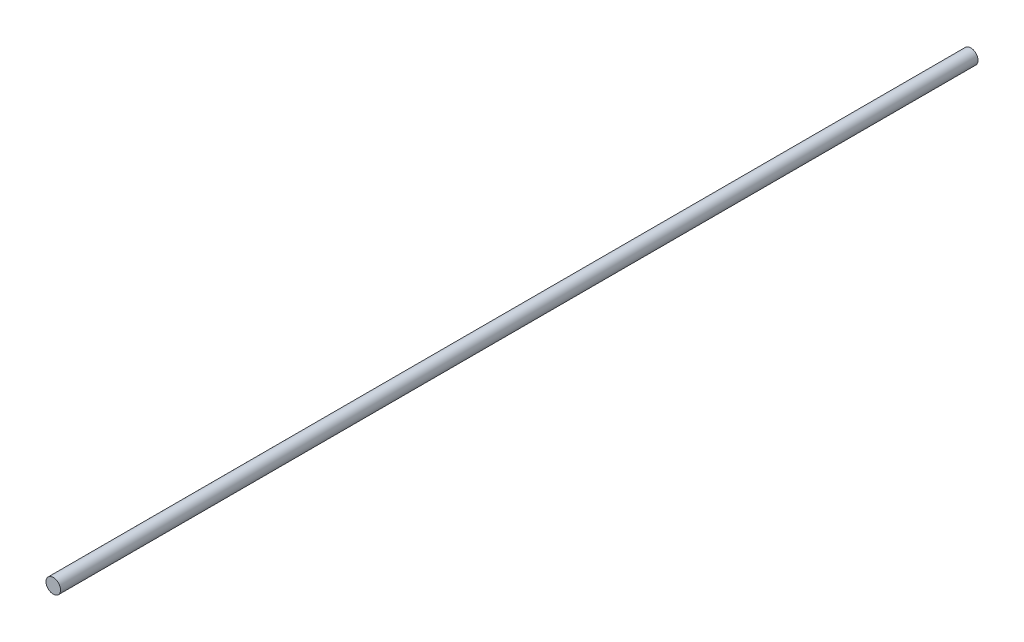
from build123d import *

# Parameters (mm, degrees)
F_3DSKETCH2_R       = 2.38125
BOSS_EXTRUDE1_DEPTH = 300


with BuildPart() as part:
    # 3DSketch2 → Boss-Extrude1 (new body)
    with BuildSketch(Plane(origin=(0, 0, 0), x_dir=(-1, 0, 0), z_dir=(0, 0, -1))):
        Circle(F_3DSKETCH2_R)
    extrude(amount=-BOSS_EXTRUDE1_DEPTH)


solid = part.part
